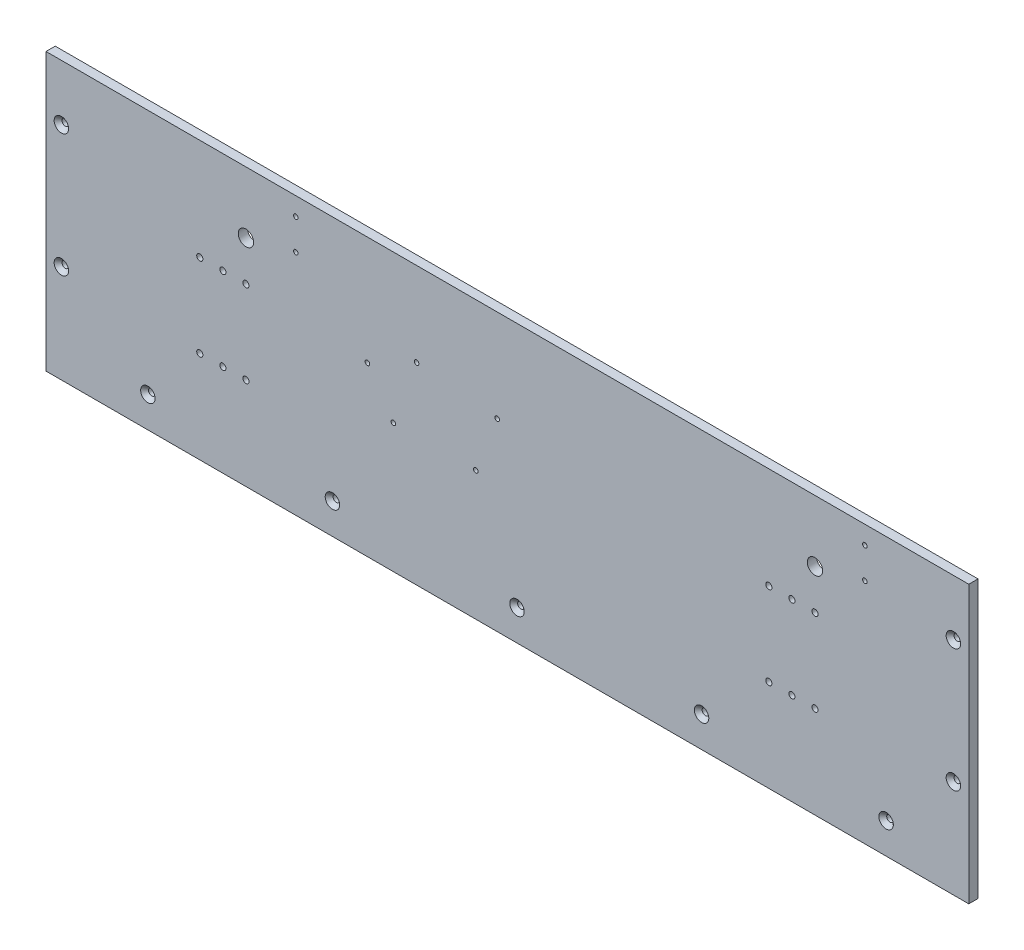
from build123d import *

# Parameters (mm, degrees)
SKETCH1_W                                       = 600
SKETCH1_H                                       = 180
BOSS_EXTRUDE1_DEPTH                             = 6
CSK_FOR_M4_FLAT_HEAD_MACHINE_SCREW1_D           = 4.3
CSK_FOR_M4_FLAT_HEAD_MACHINE_SCREW1_CSINK_D     = 9.4
CSK_FOR_M4_FLAT_HEAD_MACHINE_SCREW1_CSINK_ANGLE = 90
F_4_0MM_DOWEL_HOLE1_D                           = 4
F_3_0MM_DOWEL_HOLE1_D                           = 3
SKETCH8_R                                       = 5
CUT_EXTRUDE1_DEPTH                              = 10
F_3_0MM_DOWEL_HOLE2_D                           = 3


with BuildPart() as part:
    # Sketch1 → Boss-Extrude1 (new body)
    with BuildSketch(Plane.XY):
        with Locations((300, 90)):
            Rectangle(SKETCH1_W, SKETCH1_H)
    extrude(amount=BOSS_EXTRUDE1_DEPTH)

    # CSK for M4 Flat Head Machine Screw1 (through all)
    with Locations(Plane.XY.offset(6)):
        with Locations((546.25, 20), (590, 63.75), (426.25, 20), (306.25, 20), (186.25, 20), (66.25, 20), (10, 63.75), (590, 143.75), (10, 143.75)):
            CounterSinkHole(CSK_FOR_M4_FLAT_HEAD_MACHINE_SCREW1_D / 2, CSK_FOR_M4_FLAT_HEAD_MACHINE_SCREW1_CSINK_D / 2, counter_sink_angle=CSK_FOR_M4_FLAT_HEAD_MACHINE_SCREW1_CSINK_ANGLE)

    # Ø4.0mm Dowel Hole1 (through all)
    with Locations(Plane.XY.offset(6)):
        with Locations((500, 60), (485, 60), (470, 60), (485, 114), (470, 114), (500, 114), (130, 114), (115, 114), (100, 114), (130, 60), (115, 60), (100, 60)):
            Hole(F_4_0MM_DOWEL_HOLE1_D / 2)

    # Ø3.0mm Dowel Hole1 (through all)
    with Locations(Plane.XY.offset(6)):
        with Locations((532.43, 148.2), (532.43, 168.2), (162.43, 148.2), (162.43, 168.2)):
            Hole(F_3_0MM_DOWEL_HOLE1_D / 2)

    # Sketch8 → Cut-Extrude1 (cut)
    with BuildSketch(Plane.XY.offset(6)):
        with Locations((500, 140)):
            Circle(SKETCH8_R)
        with Locations((130, 140)):
            Circle(SKETCH8_R)
    extrude(amount=-CUT_EXTRUDE1_DEPTH, mode=Mode.SUBTRACT)

    # Ø3.0mm Dowel Hole2 (through all)
    with Locations(Plane.XY.offset(6)):
        with Locations((279.438054391, 83.83782633), (225.844054391, 83.83782633), (209.004054391, 109.16182633), (240.957054391, 125.31582633), (293.408054391, 119.90582633)):
            Hole(F_3_0MM_DOWEL_HOLE2_D / 2)


solid = part.part
